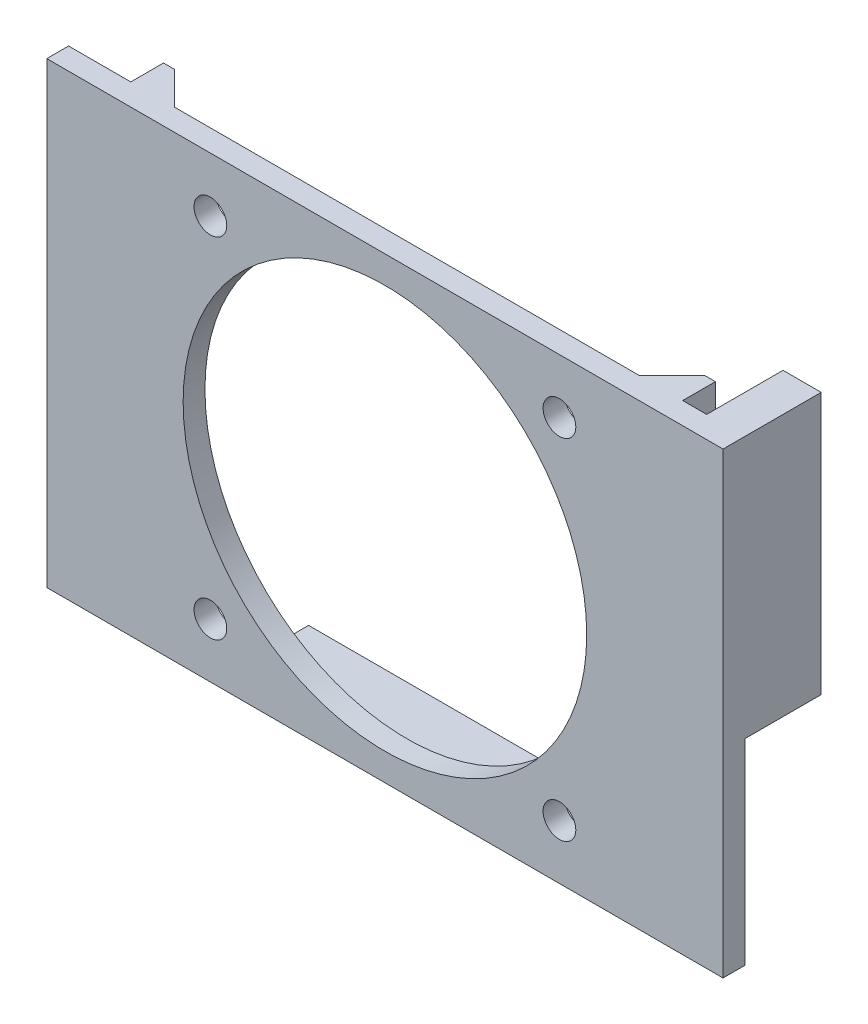
from build123d import *

# Parameters (mm, degrees)
SKETCH_1_W      = 62
SKETCH_1_H      = 42
SKETCH_1_R      = 18.5
EXTRUDE_1_DEPTH = 2
F_3_0MM_1_D     = 3
SKETCH_4_W      = 3.5
SKETCH_4_H      = 24
SKETCH_4_H_2    = 25
EXTRUDE_2_DEPTH = 7
SKETCH_5_W      = 28
SKETCH_5_H      = 2
EXTRUDE_3_DEPTH = 5
SKETCH_7_W      = 4
SKETCH_7_H      = 37
EXTRUDE_4_DEPTH = 3
CHAMFER_1_SIZE  = 3


with BuildPart() as part:
    # 스케치1 → 보스-돌출1 (new body)
    with BuildSketch(Plane.XY):
        Rectangle(SKETCH_1_W, SKETCH_1_H)
        Circle(SKETCH_1_R, mode=Mode.SUBTRACT)
    extrude(amount=EXTRUDE_1_DEPTH)

    # Ø3.0mm 맞춤핀 구멍1 (through all)
    with Locations(Plane(origin=(-16, 16, 2), x_dir=(1, 0, 0), z_dir=(0, 0, 1))):
        with Locations((0, 0), (32, 0), (32, -32), (0, -32)):
            Hole(F_3_0MM_1_D / 2)

    # 스케치4 → 보스-돌출2 (add)
    with BuildSketch(Plane(origin=(0, 0, 0), x_dir=(-1, 0, 0), z_dir=(0, 0, -1))):
        with Locations((-29.25, 9)):
            Rectangle(SKETCH_4_W, SKETCH_4_H)
        with Locations((29.25, -8.5)):
            Rectangle(SKETCH_4_W, SKETCH_4_H_2)
    extrude(amount=EXTRUDE_2_DEPTH)

    # 스케치5 → 보스-돌출3 (add)
    with BuildSketch(Plane(origin=(0, 0, 0), x_dir=(-1, 0, 0), z_dir=(0, 0, -1))):
        with Locations((0, -20)):
            Rectangle(SKETCH_5_W, SKETCH_5_H)
    extrude(amount=EXTRUDE_3_DEPTH)

    # 스케치7 → 보스-돌출4 (add)
    with BuildSketch(Plane(origin=(0, 0, 0), x_dir=(-1, 0, 0), z_dir=(0, 0, -1))):
        with Locations((-23.3, 2.5)):
            Rectangle(SKETCH_7_W, SKETCH_7_H)
        with Locations((23.3, 2.5)):
            Rectangle(SKETCH_7_W, SKETCH_7_H)
    extrude(amount=EXTRUDE_4_DEPTH)

    # 모따기1
    chamfer_1_edges = [part.edges().sort_by_distance(p)[0] for p in [
        (-21.3, 2.5, -3),
        (21.3, 2.5, -3),
    ]]
    chamfer(chamfer_1_edges, length=CHAMFER_1_SIZE - 0.0001)  # a hair under: the kernel refuses the full size


solid = part.part
